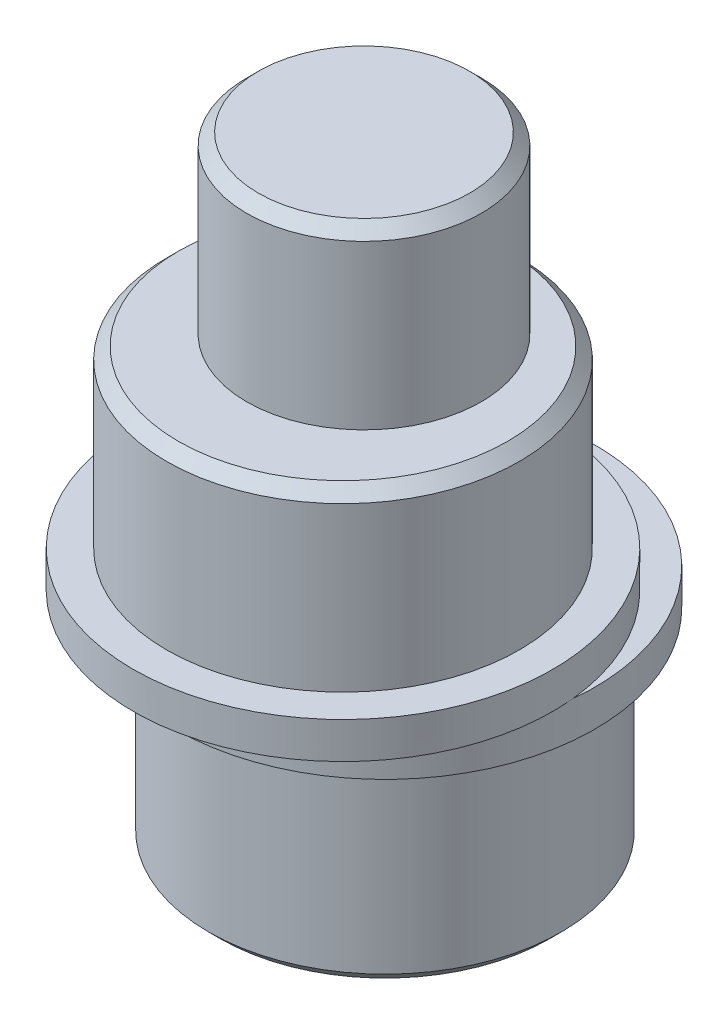
from build123d import *

# Parameters (mm, degrees)
SKETCH1_R               = 6.05
BOSS_EXTRUDE1_DEPTH     = 7
SKETCH2_R               = 7.2
BOSS_EXTRUDE2_DEPTH     = 1.25
SKETCH3_R               = 7.2
BOSS_EXTRUDE3_DEPTH     = 1.25
SKETCH4_R               = 6.05
BOSS_EXTRUDE4_DEPTH     = 6
CUT_EXTRUDE2_DEPTH      = 19.836570813
CUT_EXTRUDE2_DEPTH_BACK = 11
SKETCH6_R               = 4.025
BOSS_EXTRUDE5_DEPTH     = 6
CHAMFER1_SIZE           = 0.4
CHAMFER2_SIZE           = 0.4


with BuildPart() as part:
    # Sketch1 → Boss-Extrude1 (new body)
    with BuildSketch(Plane(origin=(0, 0, 0), x_dir=(1, 0, 0), z_dir=(0, 1, 0))):
        with Locations((0, 0.72)):
            Circle(SKETCH1_R)
    extrude(amount=BOSS_EXTRUDE1_DEPTH)

    # Sketch2 → Boss-Extrude2 (add)
    with BuildSketch(Plane(origin=(0, 7, 0), x_dir=(1, 0, 0), z_dir=(0, 1, 0))):
        with Locations((0, 0.72)):
            Circle(SKETCH2_R)
    extrude(amount=BOSS_EXTRUDE2_DEPTH)

    # Sketch3 → Boss-Extrude3 (add)
    with BuildSketch(Plane(origin=(0, 8.25, 0), x_dir=(1, 0, 0), z_dir=(0, 1, 0))):
        with Locations((0, -0.72)):
            Circle(SKETCH3_R)
    extrude(amount=BOSS_EXTRUDE3_DEPTH)

    # Sketch4 → Boss-Extrude4 (add)
    with BuildSketch(Plane(origin=(0, 9.5, 0), x_dir=(1, 0, 0), z_dir=(0, 1, 0))):
        with Locations((0, -0.72)):
            Circle(SKETCH4_R)
    extrude(amount=BOSS_EXTRUDE4_DEPTH)

    # Sketch5 → Cut-Extrude2 (cut, two sides: drawn at the far end of the back side and taken through both)
    with BuildSketch(Plane.XZ.offset(-CUT_EXTRUDE2_DEPTH_BACK)):
        with BuildLine():
            Line((1.506029548, 2.15), (-1.506029548, 2.15))
            ThreePointArc((-1.506029548, 2.15), (0, -2.625), (1.506029548, 2.15))
        make_face()
    extrude(amount=CUT_EXTRUDE2_DEPTH + CUT_EXTRUDE2_DEPTH_BACK, mode=Mode.SUBTRACT)

    # Sketch6 → Boss-Extrude5 (add)
    with BuildSketch(Plane(origin=(0, 15.5, 0), x_dir=(1, 0, 0), z_dir=(0, 1, 0))):
        Circle(SKETCH6_R)
    extrude(amount=BOSS_EXTRUDE5_DEPTH)

    # Chamfer1
    chamfer1_edges = [part.edges().sort_by_distance(p)[0] for p in [
        (-4.025, 21.5, 0),
    ]]
    chamfer(chamfer1_edges, length=CHAMFER1_SIZE)

    # Chamfer2
    chamfer2_edges = [part.edges().sort_by_distance(p)[0] for p in [
        (-6.05, 15.5, 0.72),
        (-6.05, 0, -0.72),
    ]]
    chamfer(chamfer2_edges, length=CHAMFER2_SIZE)


solid = part.part
